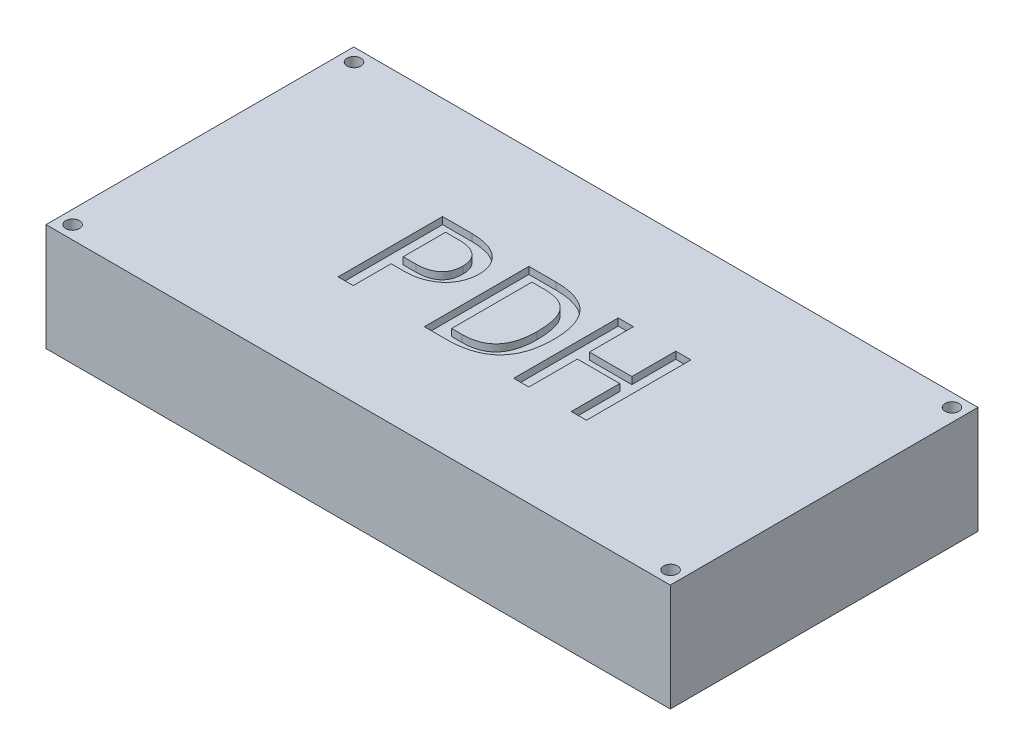
from build123d import *

# Parameters (mm, degrees)
SKETCH1_W           = 225.40000005
SKETCH1_H           = 111.10000005
SKETCH1_R           = 2.499999953
BOSS_EXTRUDE1_DEPTH = 19.38655
CUT_EXTRUDE1_DEPTH  = 2.54


with BuildPart() as part:
    # Sketch1 → Boss-Extrude1 (new, symmetric)
    with BuildSketch(Plane(origin=(0, 0, 0), x_dir=(1, 0, 0), z_dir=(0, 1, 0))):
        with Locations((112.700000025, 55.550000025)):
            Rectangle(SKETCH1_W, SKETCH1_H)
        with Locations((4.800000052, 4.800000052)):
            Circle(SKETCH1_R, mode=Mode.SUBTRACT)
        with Locations((4.800000052, 106.400000052)):
            Circle(SKETCH1_R, mode=Mode.SUBTRACT)
        with Locations((220.700000052, 106.400000052)):
            Circle(SKETCH1_R, mode=Mode.SUBTRACT)
        with Locations((220.700000052, 4.800000052)):
            Circle(SKETCH1_R, mode=Mode.SUBTRACT)
    extrude(amount=BOSS_EXTRUDE1_DEPTH, both=True)

    # Sketch2 → Cut-Extrude1 (cut)
    # profile 1 of 3: a face of its own
    with BuildSketch(Plane(origin=(0, 19.38655, 0), x_dir=(1, 0, 0), z_dir=(0, 1, 0))):
        with BuildLine():
            add(Edge.make_bspline(
                [(93.6654446, 62.638119725), (93.65621175, 62.255926888), (93.637663033, 61.488104777), (93.466421809, 60.341834085), (93.201255703, 59.201705874), (92.836997723, 58.075217304), (92.359286935, 56.979010165), (91.762331794, 55.932624231), (91.032595392, 54.955716054), (90.207106522, 54.027487516), (89.252652089, 53.179116743), (88.173798237, 52.414727304), (86.973600637, 51.734204765), (85.655660468, 51.128628725), (84.202701193, 50.653409294), (82.618753702, 50.300761726), (80.898189452, 50.099121533), (79.705954978, 50.07473573), (79.09029785, 50.062143162)],
                knots=[0, 0, 0, 0, 0.84837333, 1.704374698, 2.568122001, 3.446177459, 4.329841521, 5.219461111, 6.115085959, 7.03322926, 7.973947317, 8.94447037, 9.964314875, 11.034235969, 12.160282575, 13.352588404, 14.632904974, 16, 16, 16, 16], degree=3))
            Line((79.09029785, 50.062143162), (74.528088962, 50.062143162))
            Line((74.528088962, 50.062143162), (74.528088962, 36.39260342))
            Line((74.528088962, 36.39260342), (69.060273065, 36.39260342))
            Line((69.060273065, 36.39260342), (69.060273065, 74.120533108))
            Line((69.060273065, 74.120533108), (79.611449053, 74.120533108))
            add(Edge.make_bspline(
                [(79.611449053, 74.120533108), (80.070260309, 74.115673927), (80.980958213, 74.106028903), (82.329353652, 73.976911734), (83.651671763, 73.795021467), (84.937147693, 73.523102459), (86.171480276, 73.166358976), (87.344146306, 72.730911072), (88.422755699, 72.162952721), (89.43560104, 71.526521333), (90.368402205, 70.791840353), (91.189022047, 69.939252772), (91.912770344, 68.989458848), (92.539599198, 67.944691466), (93.055694596, 66.787250357), (93.402550005, 65.504823346), (93.635402669, 64.110350409), (93.655195832, 63.140369447), (93.6654446, 62.638119725)],
                knots=[0, 0, 0, 0, 1.071095419, 2.126025337, 3.160633674, 4.187194637, 5.191188192, 6.159546808, 7.102471747, 8.032359578, 8.950543616, 9.867691343, 10.788184798, 11.733733012, 12.707489344, 13.737062018, 14.82826569, 16, 16, 16, 16], degree=3))
        make_face()
        with BuildLine():
            add(Edge.make_bspline(
                [(88.197628703, 62.347642005), (88.192174404, 62.63850916), (88.18154377, 63.205420092), (88.067270065, 64.026417972), (87.887321266, 64.795998376), (87.642204989, 65.513494356), (87.324445545, 66.181041679), (86.9271256, 66.789508742), (86.462833318, 67.351595169), (85.92370252, 67.854044286), (85.320326107, 68.296325862), (84.670815804, 68.696121206), (83.954231053, 69.019190265), (83.180431142, 69.281086893), (82.353689397, 69.498799431), (81.465989989, 69.635809834), (80.527957319, 69.737538529), (79.882297045, 69.743319744), (79.551644817, 69.74628039)],
                knots=[0, 0, 0, 0, 1.07893025, 2.102875295, 3.069403633, 4.00867391, 4.911619206, 5.805799344, 6.69897942, 7.61127936, 8.532960211, 9.47193309, 10.436783978, 11.442898866, 12.50165651, 13.605056338, 14.773513735, 16, 16, 16, 16], degree=3))
            Line((79.551644817, 69.74628039), (74.528088962, 69.74628039))
            Line((74.528088962, 69.74628039), (74.528088962, 54.43639588))
            Line((74.528088962, 54.43639588), (79.115928237, 54.43639588))
            add(Edge.make_bspline(
                [(79.115928237, 54.43639588), (79.469215163, 54.444058583), (80.154049634, 54.458912469), (81.153694325, 54.542163566), (82.091850755, 54.691905292), (82.964265919, 54.917155421), (83.774695488, 55.18910777), (84.524586407, 55.521306188), (85.210072438, 55.925895812), (85.836535364, 56.387055958), (86.399655255, 56.909209561), (86.877940326, 57.506401351), (87.291847487, 58.157818385), (87.628287432, 58.875259995), (87.880108968, 59.657394144), (88.069138486, 60.497611643), (88.18153711, 61.401962584), (88.192147378, 62.025512532), (88.197628703, 62.347642005)],
                knots=[0, 0, 0, 0, 1.232805628, 2.389751021, 3.4973379, 4.54330244, 5.530003372, 6.477393866, 7.399377973, 8.301660217, 9.187431021, 10.070466494, 10.963674817, 11.874940633, 12.827061481, 13.825105319, 14.876436953, 16, 16, 16, 16], degree=3))
        make_face(mode=Mode.SUBTRACT)
    # profile 2 of 3: a face of its own
    with BuildSketch(Plane(origin=(0, 19.38655, 0), x_dir=(1, 0, 0), z_dir=(0, 1, 0))):
        with BuildLine():
            add(Edge.make_bspline(
                [(127.56590316, 55.675197919), (127.547617612, 54.78857119), (127.511689457, 53.046492477), (127.23969054, 50.905769989), (126.922569652, 49.262016243), (126.614411717, 48.087206761), (126.246431872, 46.950715858), (125.811824352, 45.860819894), (125.314265868, 44.812615172), (124.753130965, 43.8086857), (124.107420568, 42.863739226), (123.409082848, 41.959258432), (122.626828334, 41.117422828), (121.7596775, 40.338177311), (120.809466051, 39.618619159), (119.771337822, 38.967548349), (118.647283346, 38.391422091), (117.447711896, 37.861858683), (116.153140186, 37.424384305), (114.773384937, 37.046415803), (113.301688648, 36.744518404), (111.730514486, 36.548407326), (110.065508535, 36.414654635), (108.921503761, 36.400080642), (108.334569436, 36.39260342)],
                knots=[0, 0, 0, 0, 1.874627119, 3.68334034, 4.55511198, 5.414139205, 6.25033141, 7.080252411, 7.893905149, 8.703019486, 9.509911256, 10.312362027, 11.117881282, 11.936734267, 12.775179546, 13.635831221, 14.524848569, 15.444673208, 16.406604644, 17.411911457, 18.469143348, 19.580838344, 20.758843452, 22, 22, 22, 22], degree=3))
            Line((108.334569436, 36.39260342), (100.226823676, 36.39260342))
            Line((100.226823676, 36.39260342), (100.226823676, 74.120533108))
            Line((100.226823676, 74.120533108), (109.983457667, 74.120533108))
            add(Edge.make_bspline(
                [(109.983457667, 74.120533108), (110.698796565, 74.108775888), (112.087312401, 74.085954417), (114.099407103, 73.871359676), (115.971010991, 73.513186255), (117.705932553, 73.024742171), (119.296694788, 72.37897733), (120.753078111, 71.603929555), (122.063935524, 70.672214529), (123.234870408, 69.595919293), (124.268375898, 68.375042443), (125.15212849, 66.998343044), (125.905974417, 65.477332321), (126.520334079, 63.804439371), (126.984079723, 61.979297568), (127.323005556, 60.011417912), (127.529971236, 57.892365797), (127.553664927, 56.430354144), (127.56590316, 55.675197919)],
                knots=[0, 0, 0, 0, 1.17177347, 2.274482801, 3.310388109, 4.291013938, 5.222472681, 6.118087065, 6.988127256, 7.850034114, 8.717518086, 9.601485366, 10.523818561, 11.493740021, 12.515690363, 13.604990885, 14.762933224, 16, 16, 16, 16], degree=3))
        make_face()
        with BuildLine():
            add(Edge.make_bspline(
                [(122.098087263, 55.239481339), (122.091167759, 55.883338842), (122.07786261, 57.121378364), (121.941863816, 58.899207539), (121.714490077, 60.523833747), (121.395141619, 62.00003254), (120.973701982, 63.330931753), (120.478179626, 64.534888844), (119.856705316, 65.588603714), (119.150728012, 66.521049001), (118.340699821, 67.317635038), (117.439068976, 68.005524695), (116.438452675, 68.568612468), (115.337592989, 69.003716428), (114.147410598, 69.331977904), (112.863376849, 69.585308184), (111.475458259, 69.713259964), (110.519060263, 69.735050507), (110.026174979, 69.74628039)],
                knots=[0, 0, 0, 0, 1.413547595, 2.71803587, 3.911871408, 5.013341294, 6.029850817, 6.974090411, 7.865305992, 8.708270035, 9.535123508, 10.351794371, 11.191784495, 12.047569406, 12.944296091, 13.8996306, 14.91756238, 16, 16, 16, 16], degree=3))
            Line((110.026174979, 69.74628039), (105.694639573, 69.74628039))
            Line((105.694639573, 69.74628039), (105.694639573, 40.766856138))
            Line((105.694639573, 40.766856138), (109.462306464, 40.766856138))
            add(Edge.make_bspline(
                [(109.462306464, 40.766856138), (109.972390662, 40.779628967), (110.963897054, 40.804456912), (112.404673192, 40.959074575), (113.741396992, 41.254449715), (114.982492322, 41.645412228), (116.128283102, 42.146846942), (117.168651881, 42.778873861), (118.119824521, 43.514260641), (118.95603885, 44.379608434), (119.710984868, 45.341779056), (120.348177326, 46.429272224), (120.897700383, 47.621563924), (121.340339899, 48.927882581), (121.678563879, 50.347150333), (121.924720399, 51.877582623), (122.068484344, 53.522343822), (122.088017719, 54.655390557), (122.098087263, 55.239481339)],
                knots=[0, 0, 0, 0, 1.112402768, 2.162298815, 3.153767855, 4.092494856, 4.996014567, 5.873553179, 6.740614794, 7.610074679, 8.4907496, 9.401305331, 10.351566166, 11.349161427, 12.403455731, 13.529502205, 14.72644707, 16, 16, 16, 16], degree=3))
        make_face(mode=Mode.SUBTRACT)
    # profile 3 of 3: a face of its own
    with BuildSketch(Plane(origin=(0, 19.38655, 0), x_dir=(1, 0, 0), z_dir=(0, 1, 0))):
        Polygon((158.732453771, 36.39260342), (153.264637875, 36.39260342), (153.264637875, 53.88961429), (137.954753364, 53.88961429), (137.954753364, 36.39260342), (132.486937467, 36.39260342), (132.486937467, 74.120533108), (137.954753364, 74.120533108), (137.954753364, 58.263867007), (153.264637875, 58.263867007), (153.264637875, 74.120533108), (158.732453771, 74.120533108), align=None)
    extrude(amount=-CUT_EXTRUDE1_DEPTH, mode=Mode.SUBTRACT)


solid = part.part
